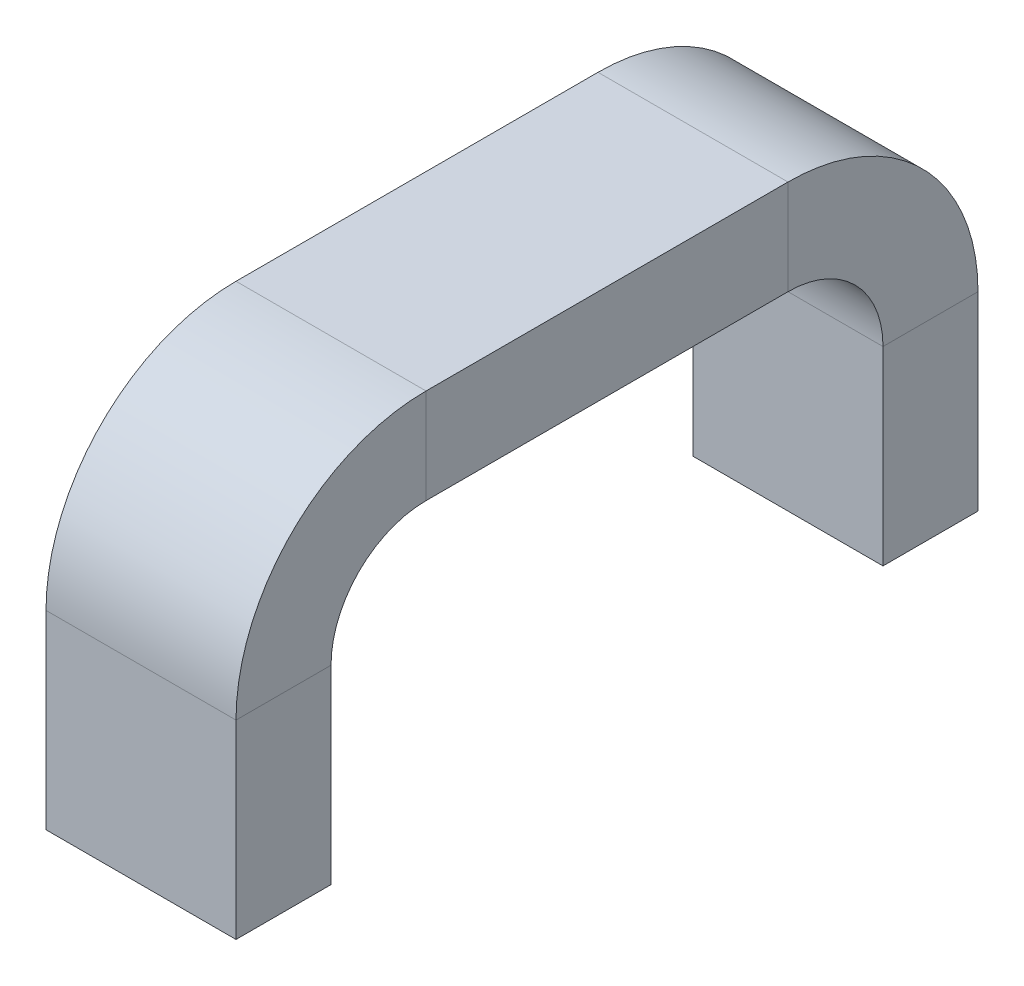
from build123d import *

# Parameters (mm, degrees)
SM_BASE_FLANGE_1_DEPTH = 20
HOLE_WIZARD_M51_D      = 5.2
HOLE_WIZARD_M51_DEPTH  = 10
HOLE_WIZARD_M51_TIP    = 1.562237609


# Sheet-metal steps are written as plain solids
with BuildPart() as part:
    # Sketch 1 → Базовая кромка1 (new body)
    with BuildSketch(Plane(origin=(0, 0, 0), x_dir=(0, 0, -1), z_dir=(1, 0, 0))):
        with BuildLine():
            Line((0, 0), (0, 20))
            ThreePointArc((0, 20), (2.928932188, 27.071067812), (10, 30))
            Line((10, 30), (48.1, 30))
            ThreePointArc((48.1, 30), (55.171067812, 27.071067812), (58.1, 20))
            Line((58.1, 20), (58.1, 0))
            Line((58.1, 0), (68.1, 0))
            Line((68.1, 0), (68.1, 20))
            ThreePointArc((68.1, 20), (62.242135624, 34.142135624), (48.1, 40))
            Line((48.1, 40), (10, 40))
            ThreePointArc((10, 40), (-4.142135624, 34.142135624), (-10, 20))
            Line((-10, 20), (-10, 0))
            Line((-10, 0), (0, 0))
        make_face()
    extrude(amount=SM_BASE_FLANGE_1_DEPTH)

    # Сверло под метчик  спиральное M51
    with Locations(Plane(origin=(0, 0, 0), x_dir=(-1, 0, 0), z_dir=(0, -1, 0))):
        with Locations((-10, 63.1), (-10, -5)):
            Hole(HOLE_WIZARD_M51_D / 2, depth=HOLE_WIZARD_M51_DEPTH)
            with Locations((0, 0, -(HOLE_WIZARD_M51_DEPTH + HOLE_WIZARD_M51_TIP / 2))):  # 118° drill point
                Cone(0, HOLE_WIZARD_M51_D / 2, HOLE_WIZARD_M51_TIP, mode=Mode.SUBTRACT)


solid = part.part
